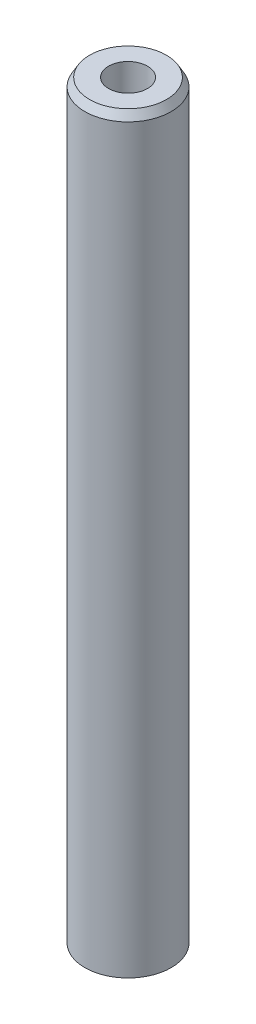
from build123d import *
from OCP.BRepFilletAPI import BRepFilletAPI_MakeChamfer

# Parameters (mm, degrees)
SKETCH1_R           = 27.5
BOSS_EXTRUDE1_DEPTH = 480.852490189
SKETCH2_R           = 12.407524257
CUT_EXTRUDE1_DEPTH  = 483.422654237
CHAMFER1_SIZE       = 5.177761743
CHAMFER1_SIZE2      = 2.989382136


with BuildPart() as part:
    # Sketch1 → Boss-Extrude1 (new body)
    with BuildSketch(Plane(origin=(0, 0, 0), x_dir=(1, 0, 0), z_dir=(0, 1, 0))):
        Circle(SKETCH1_R)
    extrude(amount=BOSS_EXTRUDE1_DEPTH)

    # Sketch2 → Cut-Extrude1 (cut, through all)
    with BuildSketch(Plane(origin=(0, 0, 0), x_dir=(1, 0, 0), z_dir=(0, 1, 0))):
        Circle(SKETCH2_R)
    extrude(amount=CUT_EXTRUDE1_DEPTH, mode=Mode.SUBTRACT)

    # Chamfer1: one chamfer whose edges measure the first distance from different faces: ONE call of the kernel's chamfer builder (chamfer() names one face for all edges)
    chamfer1_edges_1 = [part.edges().sort_by_distance(p)[0] for p in [
        (-27.5, 480.852490189, 0),
    ]]
    chamfer1_side_1 = [part.faces().sort_by_distance(p)[0] for p in [
        (-27.5, 240.426245095, 0),
    ]]
    chamfer1_edges_2 = [part.edges().sort_by_distance(p)[0] for p in [
        (-27.5, 0, 0),
    ]]
    chamfer1_side_2 = [part.faces().sort_by_distance(p)[0] for p in [
        (-26.722182541, 0, 0),
    ]]
    chamfer1 = BRepFilletAPI_MakeChamfer(part.part.solid().wrapped)
    for e in chamfer1_edges_1:
        chamfer1.Add(CHAMFER1_SIZE, CHAMFER1_SIZE2, e.wrapped, chamfer1_side_1[0].wrapped)  # the first distance lies on this face
    for e in chamfer1_edges_2:
        chamfer1.Add(CHAMFER1_SIZE, CHAMFER1_SIZE2, e.wrapped, chamfer1_side_2[0].wrapped)  # the first distance lies on this face
    add(Compound.cast(chamfer1.Shape()), mode=Mode.REPLACE)


solid = part.part
